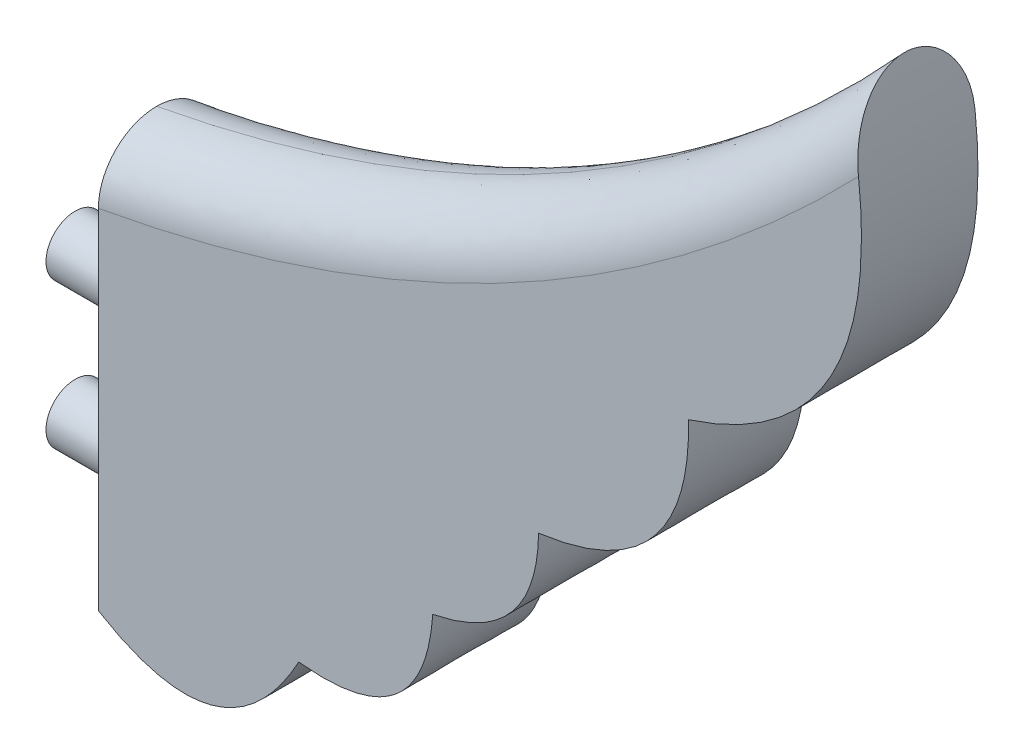
from build123d import *

# Parameters (mm, degrees)
EXTRUDE_1_DEPTH      = 5
EXTRUDE_1_DEPTH_BACK = 5
FILLET_3_R           = 5
SKETCH_2_R           = 2.5
EXTRUDE_2_DEPTH      = 7


with BuildPart() as part:
    # 草圖1 → 填料-伸長1 (new, two sides: drawn at the far end of the back side and taken through both)
    with BuildSketch(Plane.XY.offset(-EXTRUDE_1_DEPTH_BACK)):
        with BuildLine():
            Line((-32.728711913, 18.847882673), (-32.728711913, -16.152117327))
            add(Edge.make_bspline(
                [(-32.728711913, -16.152117327), (-21.783034561, -22.826167416), (-15.535655433, -11.364162116)],
                knots=[0, 0, 0, 1, 1, 1], degree=2))
            add(Edge.make_bspline(
                [(-15.535655433, -11.364162116), (-4.773052761, -12.557057066), (-4.030638728, -2.071536696)],
                knots=[0, 0, 0, 1, 1, 1], degree=2))
            add(Edge.make_bspline(
                [(5.051083958, 8.507759935), (4.922923736, -0.27289527), (-4.030638728, -2.071536696)],
                knots=[0, 0, 0, 1, 1, 1], degree=2))
            add(Edge.make_bspline(
                [(17.917796077, 23.375960607), (18.197143612, 10.254572471), (5.051083958, 8.507759935)],
                knots=[0, 0, 0, 1, 1, 1], degree=2))
            add(Edge.make_bspline(
                [(31.447225321, 54.936813216), (37.191964726, 29.582174335), (17.917796077, 23.375960607)],
                knots=[0, 0, 0, 1, 1, 1], degree=2))
            add(Edge.make_bspline(
                [(-32.728711913, 18.847882673), (5.094383594, 25.874030711), (31.447225321, 54.936813216)],
                knots=[0, 0, 0, 1, 1, 1], degree=2))
        make_face()
    extrude(amount=EXTRUDE_1_DEPTH + EXTRUDE_1_DEPTH_BACK)

    # 圓角3
    fillet_3_edges = [part.edges().sort_by_distance(p)[0] for p in [
        (2.226820149, 31.383189328, -5),
        (2.226820149, 31.383189328, 5),
    ]]
    fillet(fillet_3_edges, radius=FILLET_3_R - 0.0001)  # a hair under: the kernel refuses the full size

    # 草圖2 → 填料-伸長2 (add)
    with BuildSketch(Plane.ZY.offset(32.728711913)):
        with Locations(Location((0, 5.055113449, 0), (0, 0, 270))):
            Circle(SKETCH_2_R)
        with Locations(Location((0, -7.444886551, 0), (0, 0, 270))):
            Circle(SKETCH_2_R)
    extrude(amount=EXTRUDE_2_DEPTH)


solid = part.part
